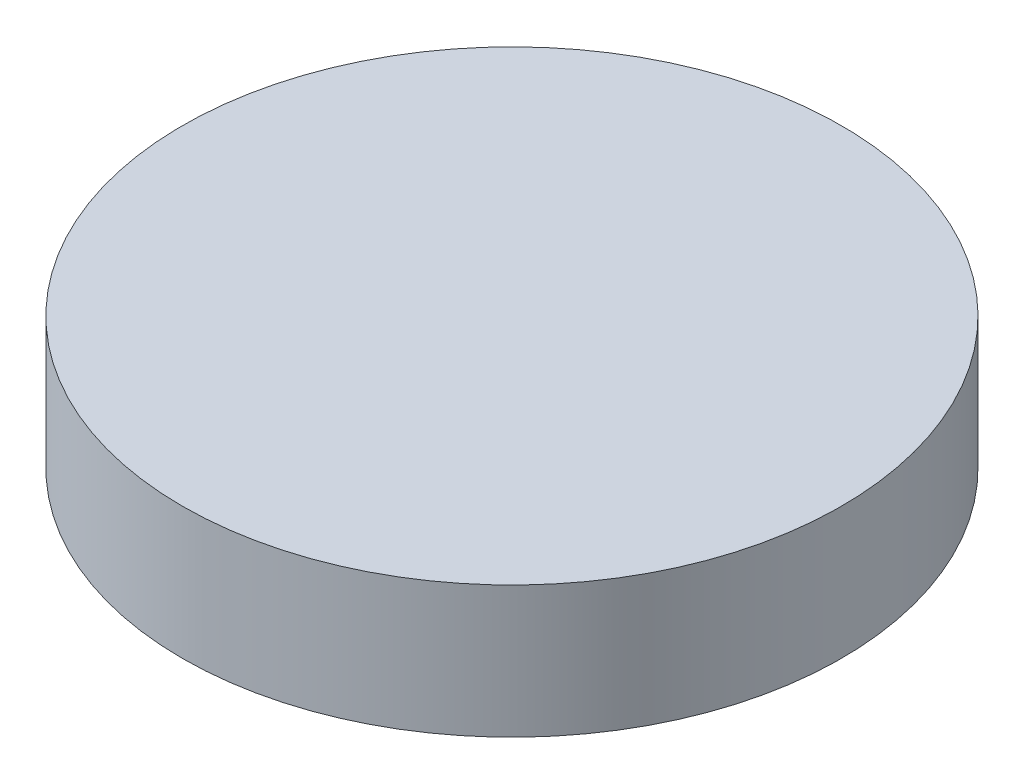
from build123d import *

# Parameters (mm, degrees)
SKETCH1_R           = 25
BOSS_EXTRUDE1_DEPTH = 10


with BuildPart() as part:
    # Sketch1 → Boss-Extrude1 (new body)
    with BuildSketch(Plane(origin=(0, 0, 0), x_dir=(1, 0, 0), z_dir=(0, 1, 0))):
        Circle(SKETCH1_R)
    extrude(amount=BOSS_EXTRUDE1_DEPTH)


solid = part.part
